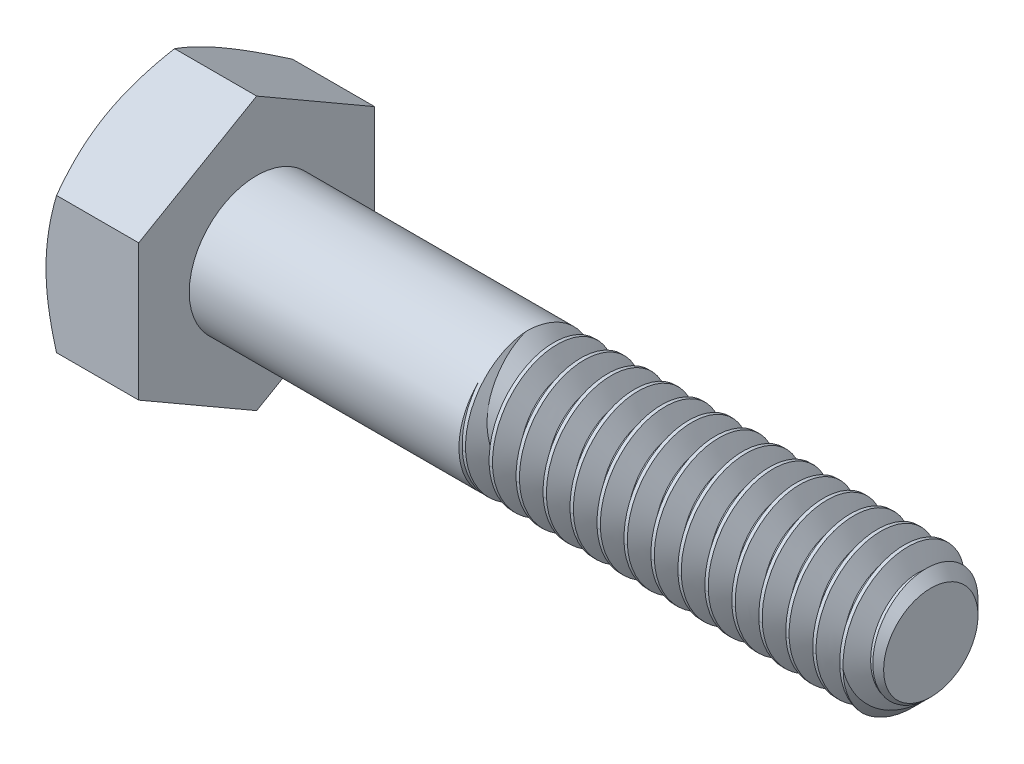
from build123d import *

# Parameters (mm, degrees)
SKETCH5_R           = 3.175
BOSS_EXTRUDE3_DEPTH = 31.75
CHAMFER1_SIZE       = 0.9525
CUT_SWEEP1_PITCH    = 1.27
BOSS_EXTRUDE4_DEPTH = 4.365625
SKETCH8_OUTSIDE_W   = 153.074
SKETCH8_OUTSIDE_H   = 154.794
SKETCH8_OUTSIDE_R   = 5.55625
CUT_EXTRUDE3_DEPTH  = 38.099499222
CUT_EXTRUDE3_DRAFT  = -60


with BuildPart() as part:
    # Sketch5 → Boss-Extrude3 (new body)
    with BuildSketch(Plane(origin=(18.0578125, 0, 0), x_dir=(0, 0, -1), z_dir=(1, 0, 0))):
        Circle(SKETCH5_R)
    extrude(amount=-BOSS_EXTRUDE3_DEPTH)

    # Chamfer1
    chamfer1_edges = [part.edges().sort_by_distance(p)[0] for p in [
        (18.0578125, 0, 3.175),
    ]]
    chamfer(chamfer1_edges, length=CHAMFER1_SIZE)

    # Cut-Sweep1: the profile of Sketch10 profile screwed along a right-hand helix of 16 turns, 8 arcs to a turn; built about Z, then put on its axis
    cut_sweep1_z = Axis((0, 0, 0), (0, 0, 1))
    cut_sweep1_corners = [(3.1753, 0, 0.000173205), (2.350110803, 0, -0.47625), (2.350110803, 0, -0.635), (3.1753, 0, -1.111423205)]
    with BuildLine(mode=Mode.PRIVATE) as cut_sweep1_profile:
        Line(cut_sweep1_corners[0], cut_sweep1_corners[1])
        Line(cut_sweep1_corners[1], cut_sweep1_corners[2])
        Line(cut_sweep1_corners[2], cut_sweep1_corners[3])
        Line(cut_sweep1_corners[3], cut_sweep1_corners[0])
    cut_sweep1_cap = Face(cut_sweep1_profile.wire())
    cut_sweep1_turn_angles = [0, 22.5, 45, 67.5, 90, 112.5, 135, 157.5, 180, 202.5, 225, 247.5, 270, 292.5, 315, 337.5, 360]
    cut_sweep1_turn_weights = [1, 0.9238795325112867, 1, 0.9238795325112867, 1, 0.9238795325112867, 1, 0.9238795325112867, 1, 0.9238795325112867, 1, 0.9238795325112867, 1, 0.9238795325112867, 1, 0.9238795325112867, 1]
    cut_sweep1_turn_rails = [Edge.make_bspline([Vector(p[0], p[1], 0).rotate(cut_sweep1_z, cut_sweep1_turn_angles[k]) / cut_sweep1_turn_weights[k] + Vector(0, 0, p[2] + CUT_SWEEP1_PITCH * cut_sweep1_turn_angles[k] / 360) for k in range(17)], [0, 0, 0, 1, 1, 2, 2, 3, 3, 4, 4, 5, 5, 6, 6, 7, 7, 8, 8, 8], 2, cut_sweep1_turn_weights) for p in cut_sweep1_corners]
    cut_sweep1_turn_sides = [Face.make_surface_from_curves(cut_sweep1_turn_rails[p[0]], cut_sweep1_turn_rails[p[1]]) for p in [(0, 1), (1, 2), (2, 3), (3, 0)]]
    cut_sweep1 = Plane(origin=(18.0578125, 0, 0), x_dir=(0, 1, 0), z_dir=(-1, 0, 0)) * Solid(Shell([*[p.moved(Location((0, 0, CUT_SWEEP1_PITCH * i))) for i in range(16) for p in cut_sweep1_turn_sides], cut_sweep1_cap, cut_sweep1_cap.rotate(cut_sweep1_z, 5760).moved(Location((0, 0, CUT_SWEEP1_PITCH * 5760 / 360)))]))
    add(cut_sweep1, mode=Mode.SUBTRACT)

    # Sketch11 → Revolve1 (revolve)
    with BuildSketch(Plane.XY, mode=Mode.PRIVATE) as revolve1_sk:
        Polygon((-13.6921875, 3.175), (-13.6921875, 0), (2.1828125, 0), (-0.9921875, 3.175), align=None)
    revolve(revolve1_sk.sketch.rotate(Axis((-13.6921875, 0, 0), (1, 0, 0)), 270), axis=Axis((-13.6921875, 0, 0), (1, 0, 0)))

    # Sketch6 → Boss-Extrude4 (add)
    with BuildSketch(Plane.ZY.offset(13.6921875)):
        Polygon((5.55625, 3.207902433), (0, 6.415804866), (-5.55625, 3.207902433), (-5.55625, -3.207902433), (0, -6.415804866), (5.55625, -3.207902433), align=None)
    extrude(amount=BOSS_EXTRUDE4_DEPTH)


with BuildPart() as cut_extrude3_tool:
    # Sketch8 outside → Cut-Extrude3 (with draft: the straight prism first)
    with BuildSketch(Plane.ZY.offset(18.0578125)):
        Rectangle(SKETCH8_OUTSIDE_W, SKETCH8_OUTSIDE_H)
        Circle(SKETCH8_OUTSIDE_R, mode=Mode.SUBTRACT)
    extrude(amount=-CUT_EXTRUDE3_DEPTH)
    # Cut-Extrude3: the draft: its side faces are tilted about the plane it starts from
    cut_extrude3_sides = [cut_extrude3_tool.faces().sort_by_distance(p)[0] for p in [
        (0.991937111, -77.397, 0),
        (0.991937111, 0, 76.537),
        (0.991937111, 77.397, 0),
        (0.991937111, 0, -76.537),
        (0.991937111, 0, -5.55625),
    ]]
    draft(cut_extrude3_sides, Plane.ZY.offset(18.0578125), CUT_EXTRUDE3_DRAFT)


with BuildPart() as part_1:
    add(part.part)

    # Cut-Extrude3: cut by cut_extrude3_tool
    add(cut_extrude3_tool.part, mode=Mode.SUBTRACT)


solid = part_1.part
